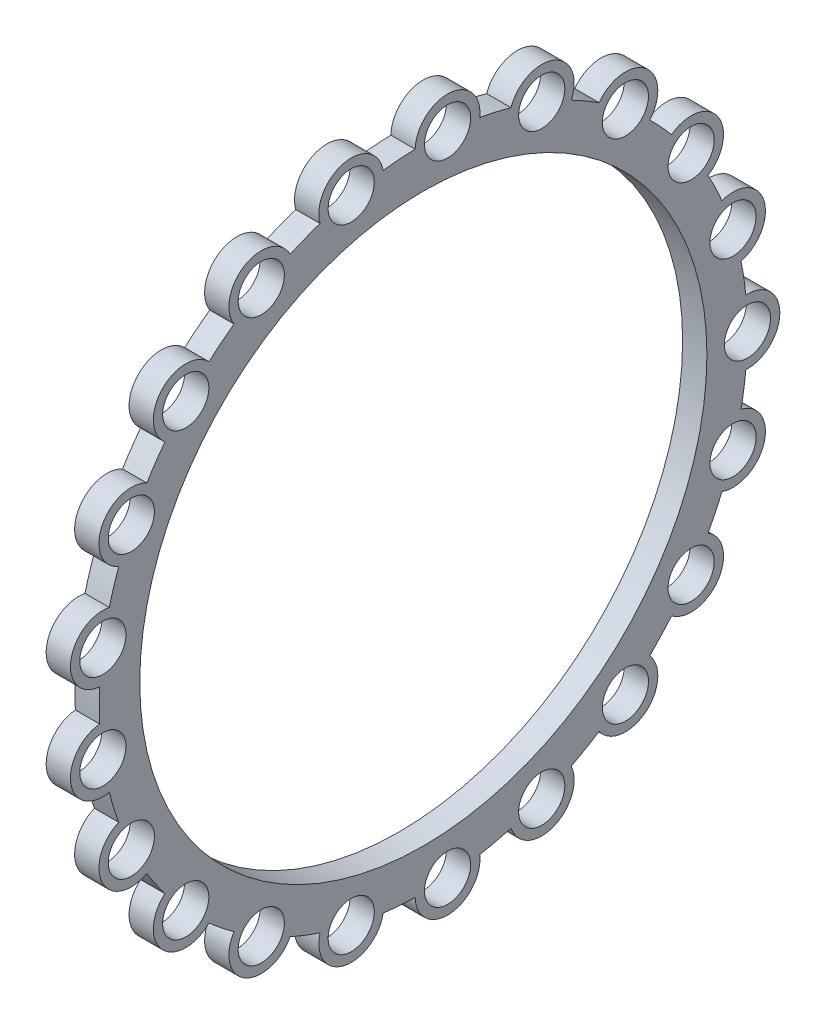
from build123d import *

# Parameters (mm, degrees)
LINEAR_AUSTRAGEN_D_NN1_OUTLINE_R = 35
LINEAR_AUSTRAGEN_D_NN1_DEPTH     = 3
F_5_7_5_7_DURCHMESSER_BOHRUNG1_D = 5.7
KREISMUSTER1_COUNT               = 21


# Read off the part's stored shape, not the designer's step: Linear-Austragen-Dünn1
with BuildPart() as part:
    # Linear-Austragen-Dünn1 outline → Linear-Austragen-Dünn1 (new body)
    with BuildSketch(Plane(origin=(0, 0, 0), x_dir=(0, 0, -1), z_dir=(1, 0, 0))):
        with BuildLine():
            ThreePointArc((39.8, -3.994996871), (44, 0), (39.8, 3.994996871))
            ThreePointArc((39.8, 3.994996871), (39.553233049, 5.961690647), (39.20934367, 7.913745572))
            ThreePointArc((39.20934367, 7.913745572), (42.045203455, 12.969227674), (36.854251671, 15.548766311))
            ThreePointArc((36.854251671, 15.548766311), (36.038754716, 17.355349565), (35.134765087, 19.119316993))
            ThreePointArc((35.134765087, 19.119316993), (36.35450607, 24.786082555), (30.633841348, 25.720959629))
            ThreePointArc((30.633841348, 25.720959629), (29.322074873, 27.206909511), (27.93830844, 28.626053195))
            ThreePointArc((27.93830844, 28.626053195), (27.433551282, 34.400585229), (21.691479788, 33.60773281))
            ThreePointArc((21.691479788, 33.60773281), (20, 34.641016151), (18.259410483, 35.589238947))
            ThreePointArc((18.259410483, 35.589238947), (16.075005072, 40.95844494), (10.821735057, 38.508311445))
            ThreePointArc((10.821735057, 38.508311445), (8.900837358, 38.997116487), (6.958083774, 39.390164638))
            ThreePointArc((6.958083774, 39.390164638), (3.288124118, 43.876967076), (-1.009568325, 39.987257618))
            ThreePointArc((-1.009568325, 39.987257618), (-2.989203744, 39.888151887), (-4.961499213, 39.69110134))
            ThreePointArc((-4.961499213, 39.69110134), (-9.790921094, 42.896828136), (-12.75116713, 37.91316047))
            ThreePointArc((-12.75116713, 37.91316047), (-14.613640975, 37.234949946), (-16.440231222, 36.465309506))
            ThreePointArc((-16.440231222, 36.465309506), (-22, 38.105117767), (-23.359768778, 32.470312635))
            ThreePointArc((-23.359768778, 32.470312635), (-24.939592074, 31.273259299), (-26.45817654, 29.999414898))
            ThreePointArc((-26.45817654, 29.999414898), (-32.254282361, 29.927600462), (-31.892752458, 24.142335029))
            ThreePointArc((-31.892752458, 24.142335029), (-33.049550973, 22.532802323), (-34.125196762, 20.867940625))
            ThreePointArc((-34.125196762, 20.867940625), (-39.642630188, 19.090884522), (-37.591925123, 13.669205009))
            ThreePointArc((-37.591925123, 13.669205009), (-38.222912231, 11.790206977), (-38.760043497, 9.882258251))
            ThreePointArc((-38.760043497, 9.882258251), (-43.508556354, 6.557859712), (-39.950890271, 1.981506137))
            ThreePointArc((-39.950890271, 1.981506137), (-40, 0), (-39.950890271, -1.981506137))
            ThreePointArc((-39.950890271, -1.981506137), (-43.508556354, -6.557859712), (-38.760043497, -9.882258251))
            ThreePointArc((-38.760043497, -9.882258251), (-38.222912231, -11.790206977), (-37.591925123, -13.669205009))
            ThreePointArc((-37.591925123, -13.669205009), (-39.642630188, -19.090884522), (-34.125196762, -20.867940625))
            ThreePointArc((-34.125196762, -20.867940625), (-33.049550973, -22.532802323), (-31.892752458, -24.142335029))
            ThreePointArc((-31.892752458, -24.142335029), (-32.254282361, -29.927600462), (-26.45817654, -29.999414898))
            ThreePointArc((-26.45817654, -29.999414898), (-24.939592074, -31.273259299), (-23.359768778, -32.470312635))
            ThreePointArc((-23.359768778, -32.470312635), (-22, -38.105117767), (-16.440231222, -36.465309506))
            ThreePointArc((-16.440231222, -36.465309506), (-14.613640975, -37.234949946), (-12.75116713, -37.91316047))
            ThreePointArc((-12.75116713, -37.91316047), (-9.790921094, -42.896828136), (-4.961499213, -39.69110134))
            ThreePointArc((-4.961499213, -39.69110134), (-2.989203744, -39.888151887), (-1.009568325, -39.987257618))
            ThreePointArc((-1.009568325, -39.987257618), (3.288124118, -43.876967076), (6.958083774, -39.390164638))
            ThreePointArc((6.958083774, -39.390164638), (8.900837358, -38.997116487), (10.821735057, -38.508311445))
            ThreePointArc((10.821735057, -38.508311445), (16.075005072, -40.95844494), (18.259410483, -35.589238947))
            ThreePointArc((18.259410483, -35.589238947), (20, -34.641016151), (21.691479788, -33.60773281))
            ThreePointArc((21.691479788, -33.60773281), (27.433551282, -34.400585229), (27.93830844, -28.626053195))
            ThreePointArc((27.93830844, -28.626053195), (29.322074873, -27.206909511), (30.633841348, -25.720959629))
            ThreePointArc((30.633841348, -25.720959629), (36.35450607, -24.786082555), (35.134765087, -19.119316993))
            ThreePointArc((35.134765087, -19.119316993), (36.038754716, -17.355349565), (36.854251671, -15.548766311))
            ThreePointArc((36.854251671, -15.548766311), (42.045203455, -12.969227674), (39.20934367, -7.913745572))
            ThreePointArc((39.20934367, -7.913745572), (39.553233049, -5.961690647), (39.8, -3.994996871))
        make_face()
        Circle(LINEAR_AUSTRAGEN_D_NN1_OUTLINE_R, mode=Mode.SUBTRACT)
    extrude(amount=LINEAR_AUSTRAGEN_D_NN1_DEPTH)

    # Ø5.7 (5.7) Durchmesser Bohrung1 (through all)
    with Locations(Plane(origin=(3, 0, 0), x_dir=(0, 0, -1), z_dir=(1, 0, 0))):
        with Locations((40, 0)):
            f_5_7_5_7_durchmesser_bohrung1 = Hole(F_5_7_5_7_DURCHMESSER_BOHRUNG1_D / 2)

    # Kreismuster1: Ø5.7 (5.7) Durchmesser Bohrung1 ×21 about axis
    kreismuster1_axis = Axis((0, 0, 0), (1, 0, 0))
    for i in range(1, KREISMUSTER1_COUNT):
        add(f_5_7_5_7_durchmesser_bohrung1.rotate(kreismuster1_axis, i * 360 / KREISMUSTER1_COUNT), mode=Mode.SUBTRACT)


solid = part.part
